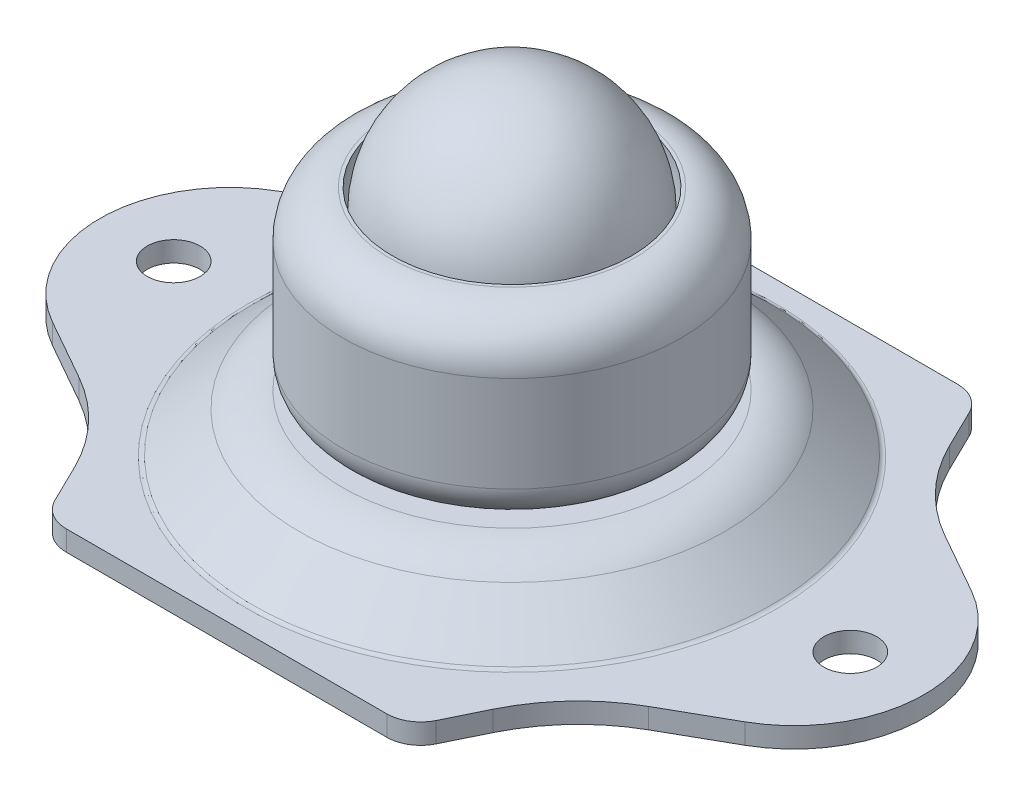
from build123d import *

# Parameters (mm, degrees)
SKETCH9_OUTSIDE_W   = 82.19
SKETCH9_OUTSIDE_H   = 82.19
CUT_EXTRUDE3_DEPTH  = 52.016579336
SKETCH8_R           = 1.984375
CUT_EXTRUDE1_DEPTH  = 46.013158695
BOSS_EXTRUDE2_START = -0.762
SKETCH7_R           = 10.307047551
BOSS_EXTRUDE2_DEPTH = 2.286


# Read off the part's stored shape, not the designer's step: Move Face1
with BuildPart() as part:
    # Sketch4 → Revolve3 (revolve)
    with BuildSketch(Plane.XY, mode=Mode.PRIVATE) as revolve3_sk:
        with BuildLine():
            Line((19.515272333, 1.644486874), (15.984776665, 4.637131257))
            ThreePointArc((15.984776665, 4.637131257), (14.449390353, 5.531280176), (12.7, 5.842))
            Line((12.7, 5.842), (9.4059375, 5.842))
            Line((9.4059375, 5.842), (9.4059375, 4.318))
            Line((9.4059375, 4.318), (12.7, 4.318))
            ThreePointArc((12.7, 4.318), (13.924573247, 4.100496123), (14.999343666, 3.47459188))
            Line((14.999343666, 3.47459188), (18.529839334, 0.481947497))
            ThreePointArc((18.529839334, 0.481947497), (19.143993859, 0.12428793), (19.84375, 0))
            Line((19.84375, 0), (30.95625, 0))
            Line((30.95625, 0), (30.95625, 1.524))
            Line((30.95625, 1.524), (19.84375, 1.524))
            ThreePointArc((19.84375, 1.524), (19.668810965, 1.555071982), (19.515272333, 1.644486874))
        make_face()
    revolve(revolve3_sk.sketch.rotate(Axis((0, 19.05, 0), (0, -1, 0)), 180), axis=Axis((0, 19.05, 0), (0, -1, 0)))

    # Sketch9 outside → Cut-Extrude3 (cut, through all)
    with BuildSketch(Plane(origin=(0, 0, 0), x_dir=(1, 0, 0), z_dir=(0, 1, 0))):
        Rectangle(SKETCH9_OUTSIDE_W, SKETCH9_OUTSIDE_H)
        with BuildLine():
            Line((-14.314886108, 20.006407376), (-15.720512319, 17.129868982))
            ThreePointArc((-15.720512319, 17.129868982), (-18.094123839, 13.696033599), (-21.378014937, 11.118958448))
            Line((-21.378014937, 11.118958448), (-25.998285744, 8.503638382))
            ThreePointArc((-25.998285744, 8.503638382), (-30.95625, 0), (-25.998285744, -8.503638382))
            Line((-25.998285744, -8.503638382), (-21.378014937, -11.118958448))
            ThreePointArc((-21.378014937, -11.118958448), (-18.094123839, -13.696033599), (-15.720512319, -17.129868982))
            Line((-15.720512319, -17.129868982), (-14.314886108, -20.006407376))
            ThreePointArc((-14.314886108, -20.006407376), (-13.377971754, -21.045791684), (-12.032776552, -21.43125))
            Line((-12.032776552, -21.43125), (12.032776552, -21.43125))
            ThreePointArc((12.032776552, -21.43125), (13.377971754, -21.045791684), (14.314886108, -20.006407376))
            Line((14.314886108, -20.006407376), (15.720512319, -17.129868982))
            ThreePointArc((15.720512319, -17.129868982), (18.094123839, -13.696033599), (21.378014937, -11.118958448))
            Line((21.378014937, -11.118958448), (25.998285744, -8.503638382))
            ThreePointArc((25.998285744, -8.503638382), (30.95625, 0), (25.998285744, 8.503638382))
            Line((25.998285744, 8.503638382), (21.378014937, 11.118958448))
            ThreePointArc((21.378014937, 11.118958448), (18.094123839, 13.696033599), (15.720512319, 17.129868982))
            Line((15.720512319, 17.129868982), (14.314886108, 20.006407376))
            ThreePointArc((14.314886108, 20.006407376), (13.377971754, 21.045791684), (12.032776552, 21.43125))
            Line((12.032776552, 21.43125), (-12.032776552, 21.43125))
            ThreePointArc((-12.032776552, 21.43125), (-13.377971754, 21.045791684), (-14.314886108, 20.006407376))
        make_face(mode=Mode.SUBTRACT)
    extrude(amount=CUT_EXTRUDE3_DEPTH, mode=Mode.SUBTRACT)

    # Sketch8 → Cut-Extrude1 (cut, through all)
    with BuildSketch(Plane(origin=(0, 1.524, 0), x_dir=(1, 0, 0), z_dir=(0, 1, 0))):
        with Locations(Location((-25.4, 0, 0), (0, 0, 180))):
            Circle(SKETCH8_R)
        with Locations(Location((25.4, 0, 0), (0, 0, 180))):
            Circle(SKETCH8_R)
    extrude(amount=-CUT_EXTRUDE1_DEPTH, mode=Mode.SUBTRACT)


with BuildPart() as body_2:
    # Sketch1 → Revolve1 (revolve)
    with BuildSketch(Plane.XY, mode=Mode.PRIVATE) as revolve1_sk:
        with BuildLine():
            Line((9.220718975, 19.05), (0, 19.05))
            Line((0, 19.05), (0, 1.27))
            Line((0, 1.27), (8.529047551, 1.27))
            Line((8.529047551, 1.27), (9.4059375, 5.842))
            Line((9.4059375, 5.842), (10.16, 5.842))
            ThreePointArc((10.16, 5.842), (11.956051224, 6.585948776), (12.7, 8.382))
            Line((12.7, 8.382), (12.7, 15.570718975))
            ThreePointArc((12.7, 15.570718975), (11.680942181, 18.030942181), (9.220718975, 19.05))
        make_face()
    revolve(revolve1_sk.sketch.rotate(Axis((0, 19.05, 0), (0, -1, 0)), 180), axis=Axis((0, 19.05, 0), (0, -1, 0)))

    # Sketch3<2> → Cut-Revolve1 (revolve, cut)
    with BuildSketch(Plane.XY):
        with BuildLine():
            Line((0, 26.19375), (0, 8.73125))
            ThreePointArc((0, 8.73125), (8.73125, 17.4625), (0, 26.19375))
        make_face()
    revolve(axis=Axis((0, 26.19375, 0), (0, -1, 0)), mode=Mode.SUBTRACT)

    # Move Face1 outline → Move Face1 (revolve, cut)
    with BuildSketch(Plane.XY):
        with BuildLine():
            Line((0, 8.73125), (0, 8.35025))
            ThreePointArc((0, 8.35025), (6.982076948, 11.607271435), (8.972900522, 19.050000009))
            Line((8.972900522, 19.050000009), (8.585718973, 19.050000009))
            ThreePointArc((8.585718973, 19.050000009), (6.711765268, 11.877973739), (0, 8.73125))
        make_face()
    revolve(axis=Axis((0, 0, 0), (0, 1, 0)), mode=Mode.SUBTRACT)

    # Sketch7 → Boss-Extrude2 (add)
    with BuildSketch(Plane.XZ.offset(-1.27).offset(BOSS_EXTRUDE2_START)):
        Circle(SKETCH7_R)
    extrude(amount=-BOSS_EXTRUDE2_DEPTH)


with BuildPart() as body_3:
    # Sketch3 → Revolve2 (revolve)
    with BuildSketch(Plane.XY):
        with BuildLine():
            Line((0, 26.19375), (0, 8.73125))
            ThreePointArc((0, 8.73125), (8.73125, 17.4625), (0, 26.19375))
        make_face()
    revolve(axis=Axis((0, 26.19375, 0), (0, -1, 0)))


solid = Compound([part.part, body_2.part, body_3.part])
